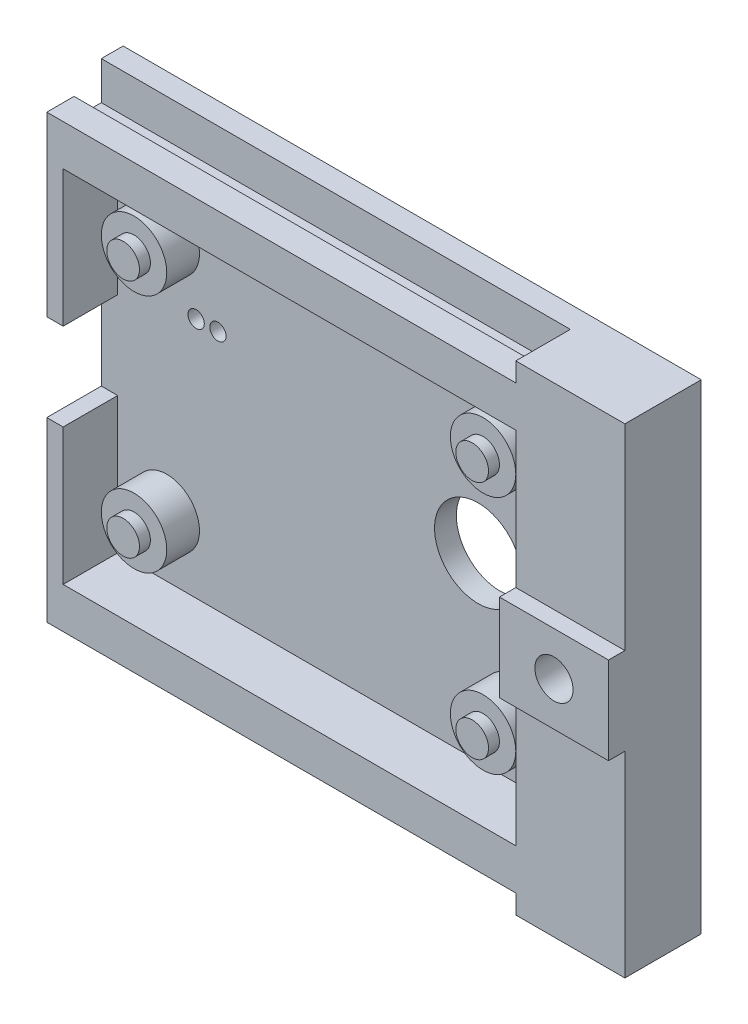
from build123d import *
from build123d.topology import SkipClean

# Parameters (mm, degrees)
CROQUIS1_W              = 53
CROQUIS1_H              = 44
CROQUIS1_R              = 0.75
CROQUIS1_R_2            = 4
SALIENTE_EXTRUIR1_DEPTH = 2
CROQUIS4_R              = 1.5
SALIENTE_EXTRUIR3_DEPTH = 4
CORTAR_EXTRUIR1_REACH   = 40.484
CROQUIS5_R              = 1.75
CROQUIS6_R              = 1.75
CROQUIS6_W              = 41.5
CROQUIS6_H              = 33
SALIENTE_EXTRUIR4_DEPTH = 5
CROQUIS7_W              = 43
CROQUIS7_H              = 1.75
SALIENTE_EXTRUIR5_DEPTH = 2.5
CROQUIS8_W              = 1.5
CROQUIS8_H              = 8
CORTAR_EXTRUIR3_DEPTH   = 5
CROQUIS9_R              = 3.5
CORTAR_EXTRUIR4_DEPTH   = 5
CROQUIS10_R             = 3
SALIENTE_EXTRUIR6_DEPTH = 3
CROQUIS12_W             = 10
CROQUIS12_H             = 8
CROQUIS12_R             = 1.75
SALIENTE_EXTRUIR7_DEPTH = 1.5


with BuildPart() as part:
    # Croquis1 → Saliente-Extruir1 (new body)
    with BuildSketch(Plane.XY):
        with Locations((4.5, 0)):
            Rectangle(CROQUIS1_W, CROQUIS1_H)
        with Locations((-13.3084, 5.6686)):
            Circle(CROQUIS1_R, mode=Mode.SUBTRACT)
        with Locations((-11.3084, 5.6686)):
            Circle(CROQUIS1_R, mode=Mode.SUBTRACT)
        with Locations((12.55, 0)):
            Circle(CROQUIS1_R_2, mode=Mode.SUBTRACT)
    extrude(amount=SALIENTE_EXTRUIR1_DEPTH)

    # Croquis4 → Saliente-Extruir3 (add)
    with BuildSketch(Plane.XY.offset(2)):
        with Locations((-16, -11)):
            Circle(CROQUIS4_R)
        with Locations((16, -11)):
            Circle(CROQUIS4_R)
        with Locations((16, 11)):
            Circle(CROQUIS4_R)
        with Locations((-16, 11)):
            Circle(CROQUIS4_R)
    extrude(amount=SALIENTE_EXTRUIR3_DEPTH)

    # Croquis5 → Cortar-Extruir1 (cut, up to next)
    with BuildSketch(Plane(origin=(0, 0, 0), x_dir=(-1, 0, 0), z_dir=(0, 0, -1)), mode=Mode.PRIVATE) as cortar_extruir1_sk1:
        with Locations((-26, 0)):
            Circle(CROQUIS5_R)
    cortar_extruir1_tool1 = extrude(cortar_extruir1_sk1.sketch, amount=-CORTAR_EXTRUIR1_REACH, mode=Mode.PRIVATE) & part.part
    add(cortar_extruir1_tool1.solids().sort_by_distance((26, 0, 0))[0], mode=Mode.SUBTRACT)

    # Croquis6 → Saliente-Extruir4 (add)
    with SkipClean():  # the faces are left unmerged after this step: merging them gives an invalid solid
        with BuildSketch(Plane.XY.offset(2)):
            Polygon((-22, -18.5), (21, -18.5), (21, -22), (31, -22), (31, 22), (21, 22), (21, 18.5), (-22, 18.5), align=None)
            with Locations((26, 0)):
                Circle(CROQUIS6_R, mode=Mode.SUBTRACT)
            with Locations((0.25, 0)):
                Rectangle(CROQUIS6_W, CROQUIS6_H, mode=Mode.SUBTRACT)
        extrude(amount=SALIENTE_EXTRUIR4_DEPTH)

    # Croquis7 → Saliente-Extruir5 (add)
    with SkipClean():  # the faces are left unmerged after this step: merging them gives an invalid solid
        with BuildSketch(Plane.XY.offset(7)):
            with Locations((-0.5, 19.375)):
                Rectangle(CROQUIS7_W, CROQUIS7_H)
            with Locations((-0.5, -19.375)):
                Rectangle(CROQUIS7_W, CROQUIS7_H)
        extrude(amount=-SALIENTE_EXTRUIR5_DEPTH)

    # Croquis8 → Cortar-Extruir3 (cut)
    with SkipClean():  # the faces are left unmerged after this step: merging them gives an invalid solid
        with BuildSketch(Plane.XY.offset(7)):
            with Locations((-21.25, 0)):
                Rectangle(CROQUIS8_W, CROQUIS8_H)
        extrude(amount=-CORTAR_EXTRUIR3_DEPTH, mode=Mode.SUBTRACT)

    # Croquis9 → Cortar-Extruir4 (cut)
    with BuildSketch(Plane(origin=(0, 0, 0), x_dir=(-1, 0, 0), z_dir=(0, 0, -1))):
        with Locations((-26, 0)):
            Circle(CROQUIS9_R)
    extrude(amount=-CORTAR_EXTRUIR4_DEPTH, mode=Mode.SUBTRACT)

    # Croquis10 → Saliente-Extruir6 (add)
    with BuildSketch(Plane.XY.offset(2)):
        with Locations((-16, 11)):
            Circle(CROQUIS10_R)
        with Locations((16, 11)):
            Circle(CROQUIS10_R)
        with Locations((16, -11)):
            Circle(CROQUIS10_R)
        with Locations((-16, -11)):
            Circle(CROQUIS10_R)
    extrude(amount=SALIENTE_EXTRUIR6_DEPTH)

    # Croquis12 → Saliente-Extruir7 (add)
    with BuildSketch(Plane.XY.offset(7)):
        with Locations((26, 0)):
            Rectangle(CROQUIS12_W, CROQUIS12_H)
        with Locations((26, 0)):
            Circle(CROQUIS12_R, mode=Mode.SUBTRACT)
    extrude(amount=SALIENTE_EXTRUIR7_DEPTH)


solid = part.part
